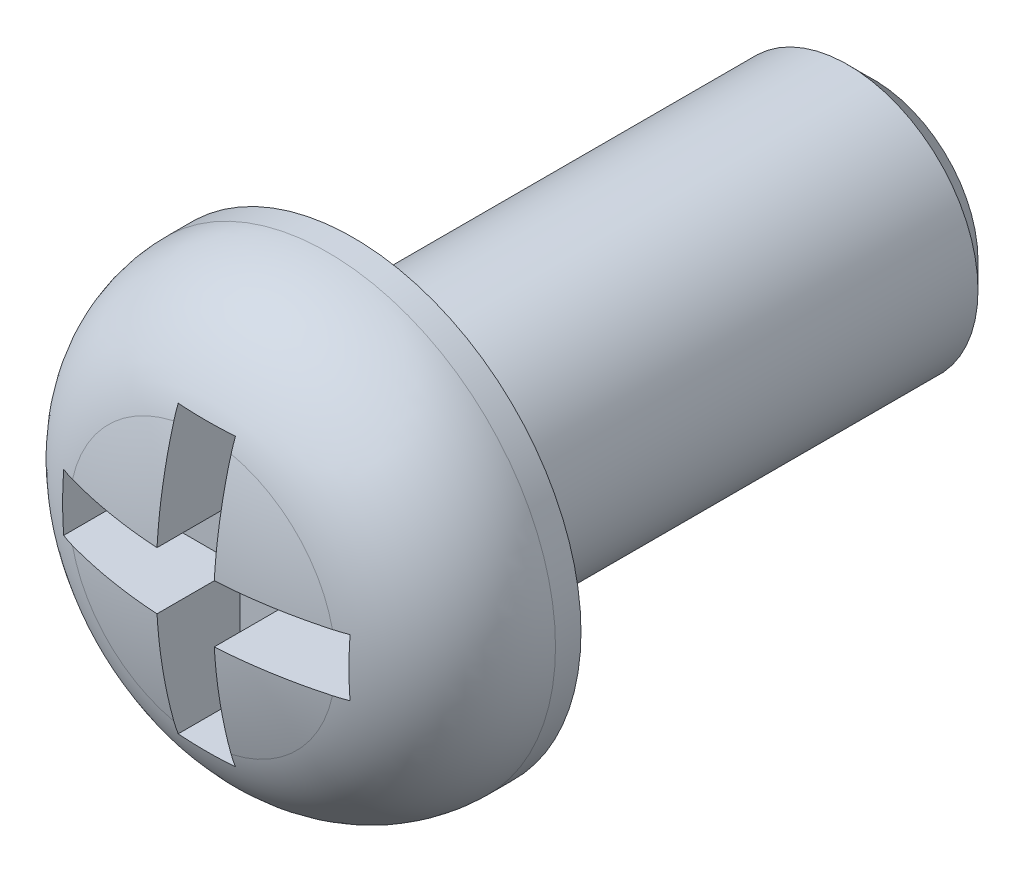
from build123d import *

# Parameters (mm, degrees)
CUT_EXTRUDE2_DEPTH = 0.65
CHAMFER1_SIZE      = 0.2


with BuildPart() as part:
    # Sketch1 → Revolve1 (revolve)
    with BuildSketch(Plane(origin=(0, 0, 0), x_dir=(0, 0, -1), z_dir=(1, 0, 0)), mode=Mode.PRIVATE) as revolve1_sk:
        with BuildLine():
            Line((-0.866666667, 1.75), (0, 1.75))
            Line((0, 1.75), (0, 1))
            Line((0, 1), (4, 1))
            Line((4, 1), (4, 0))
            Line((4, 0), (-1.3, 0))
            ThreePointArc((-1.3, 0), (-1.190055087, 0.901426339), (-0.866666667, 1.75))
        make_face()
    revolve(revolve1_sk.sketch.rotate(Axis((0, 0, 33.735969773), (0, 0, -1)), 90), axis=Axis((0, 0, 33.735969773), (0, 0, -1)))

    # Sketch2 → Cut-Extrude2 (cut)
    with BuildSketch(Plane(origin=(0, 0, 1.3), x_dir=(-1, 0, 0), z_dir=(0, 0, -1))):
        Polygon((0, 1.1), (0.22, 1.1), (0.22, 0.22), (1.1, 0.22), (1.1, 0), (1.1, -0.22), (0.22, -0.22), (0.22, -1.1), (0, -1.1), (-0.22, -1.1), (-0.22, -0.22), (-1.1, -0.22), (-1.1, 0), (-1.1, 0.22), (-0.22, 0.22), (-0.22, 1.1), align=None)
    extrude(amount=CUT_EXTRUDE2_DEPTH, mode=Mode.SUBTRACT)

    # Fillet1: read off the stored shape, not the designer's step
    # Fillet1 outline → Fillet1 (revolve, cut)
    with BuildSketch(Plane.XZ):
        with BuildLine():
            Line((1.75, 1.157864333), (1.02269549, 1.157864333))
            ThreePointArc((1.02269549, 1.157864333), (1.547714075, 0.798799804), (1.75, 0.195763938))
            Line((1.75, 0.195763938), (1.75, 1.157864333))
        make_face()
    revolve(axis=Axis((0, 0, 0), (0, 0, 1)), mode=Mode.SUBTRACT)

    # Chamfer1
    chamfer1_edges = [part.edges().sort_by_distance(p)[0] for p in [
        (-1, 0, -4),
    ]]
    chamfer(chamfer1_edges, length=CHAMFER1_SIZE)


solid = part.part
